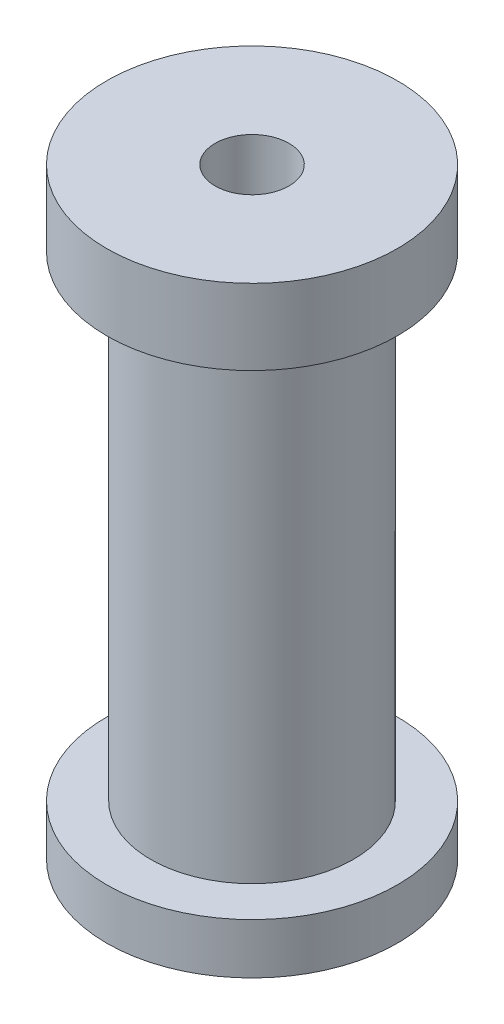
from build123d import *

# Parameters (mm, degrees)
SKETCH1_R           = 13.4366
BOSS_EXTRUDE1_DEPTH = 4.6736
SKETCH2_R           = 9.3726
BOSS_EXTRUDE2_DEPTH = 43.942
SKETCH3_R           = 13.4366
BOSS_EXTRUDE3_DEPTH = 6.985
SKETCH4_R           = 3.4163
CUT_EXTRUDE1_DEPTH  = 59.758073143


with BuildPart() as part:
    # Sketch1 → Boss-Extrude1 (new body)
    with BuildSketch(Plane(origin=(0, 0, 0), x_dir=(1, 0, 0), z_dir=(0, 1, 0))):
        Circle(SKETCH1_R)
    extrude(amount=BOSS_EXTRUDE1_DEPTH)

    # Sketch2 → Boss-Extrude2 (add)
    with BuildSketch(Plane(origin=(0, 4.6736, 0), x_dir=(1, 0, 0), z_dir=(0, 1, 0))):
        Circle(SKETCH2_R)
    extrude(amount=BOSS_EXTRUDE2_DEPTH)

    # Sketch3 → Boss-Extrude3 (add)
    with BuildSketch(Plane(origin=(0, 48.6156, 0), x_dir=(1, 0, 0), z_dir=(0, 1, 0))):
        Circle(SKETCH3_R)
    extrude(amount=BOSS_EXTRUDE3_DEPTH)

    # Sketch4 → Cut-Extrude1 (cut, through all)
    with BuildSketch(Plane.XZ):
        Circle(SKETCH4_R)
    extrude(amount=-CUT_EXTRUDE1_DEPTH, mode=Mode.SUBTRACT)


solid = part.part
